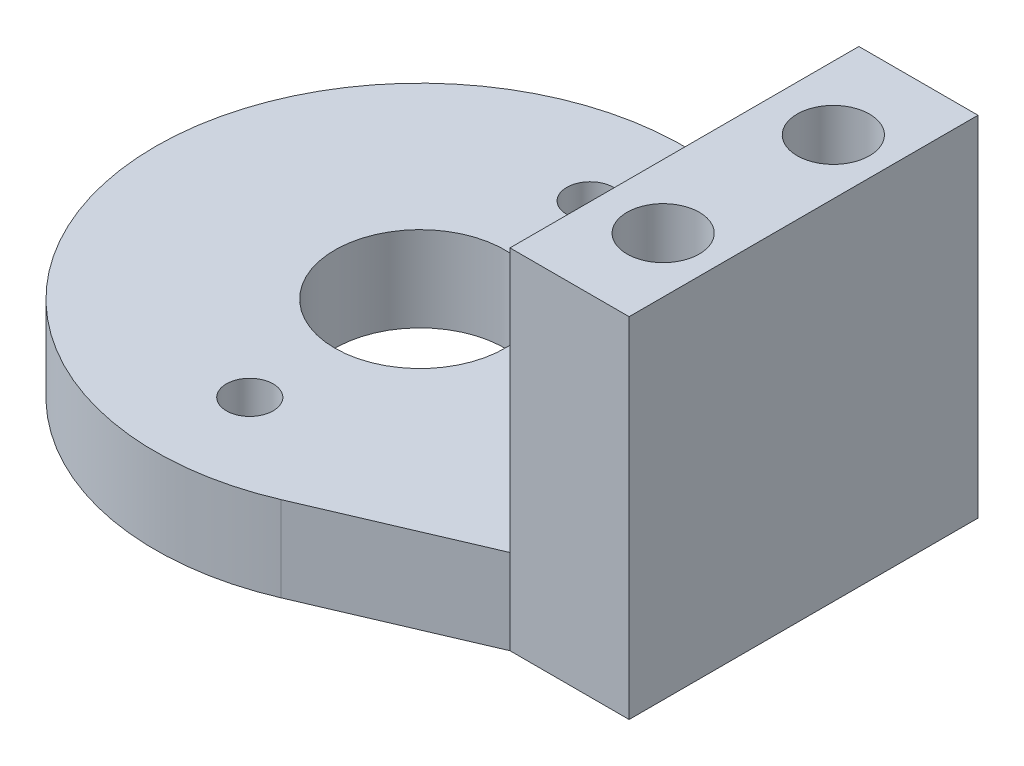
from build123d import *

# Parameters (mm, degrees)
SKETCH1_W               = 7
SKETCH1_H               = 20.5
MOUNTINGBASE_DEPTH      = 20.50030868
SKETCH2_R               = 2.125
MOUNTINGHOLES_DEPTH     = 30.824698757
HORNTAB_DEPTH           = 5
SKETCH4_R               = 1.375
SKETCH4_R_2             = 5
HORNMOUNTINGHOLES_DEPTH = 5


with BuildPart() as part:
    # Sketch1 → mountingBase (new body)
    with BuildSketch(Plane(origin=(0, 0, 0), x_dir=(1, 0, 0), z_dir=(0, 1, 0))):
        with Locations((3.5, -10.25)):
            Rectangle(SKETCH1_W, SKETCH1_H)
    extrude(amount=MOUNTINGBASE_DEPTH)

    # Sketch2 → mountingHoles (cut, through all)
    with BuildSketch(Plane(origin=(0, 20.50030868, 0), x_dir=(1, 0, 0), z_dir=(0, 1, 0))):
        with Locations((3.75, -5.25)):
            Circle(SKETCH2_R)
        with Locations((3.75, -15.25)):
            Circle(SKETCH2_R)
    extrude(amount=-MOUNTINGHOLES_DEPTH, mode=Mode.SUBTRACT)

    # Sketch3 → hornTab (add)
    with BuildSketch(Plane(origin=(0, 0, 0), x_dir=(1, 0, 0), z_dir=(0, 1, 0))):
        with BuildLine():
            Line((0, 0), (-9.422358224, 4.035054584))
            ThreePointArc((-9.422358224, 4.035054584), (-31.07965246, -10.25), (-9.422358224, -24.535054584))
            Line((-9.422358224, -24.535054584), (0, -20.5))
            Line((0, -20.5), (0, 0))
        make_face()
    extrude(amount=HORNTAB_DEPTH)

    # Sketch4 → hornMountingHoles (cut)
    with BuildSketch(Plane(origin=(0, 5, 0), x_dir=(1, 0, 0), z_dir=(0, 1, 0))):
        with Locations((-15.53982623, -0.25)):
            Circle(SKETCH4_R)
        with Locations((-15.53982623, -20.25)):
            Circle(SKETCH4_R)
        with Locations((-15.53982623, -10.25)):
            Circle(SKETCH4_R_2)
    extrude(amount=-HORNMOUNTINGHOLES_DEPTH, mode=Mode.SUBTRACT)


solid = part.part
